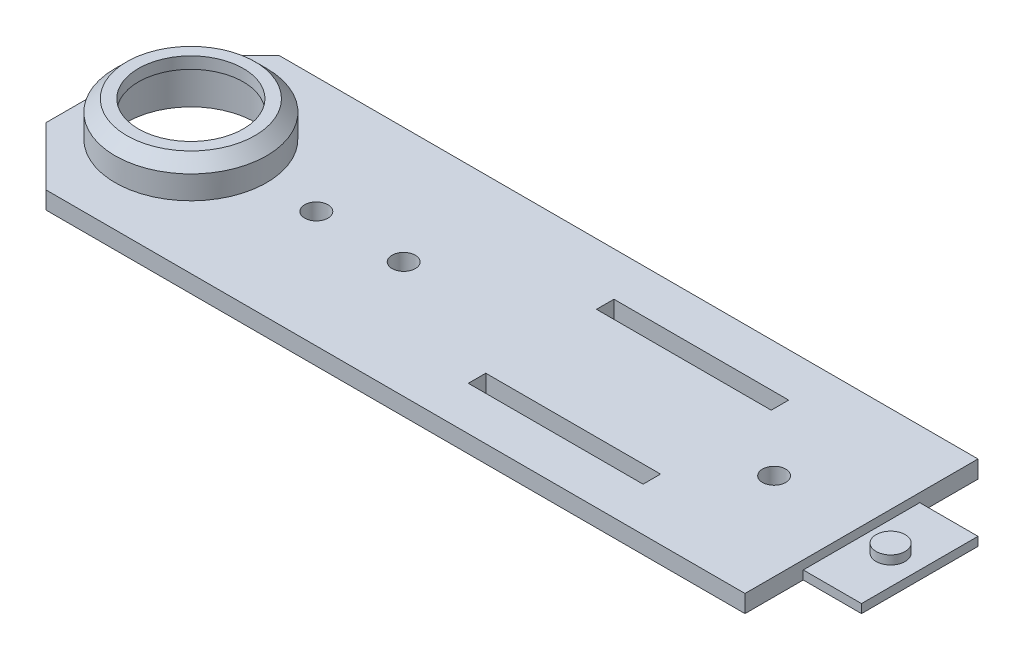
from build123d import *

# Parameters (mm, degrees)
CROQUIS1_R              = 11
CROQUIS1_R_2            = 2
CROQUIS1_W              = 30
CROQUIS1_H              = 3
SALIENTE_EXTRUIR1_DEPTH = 3
CROQUIS2_R              = 13
CROQUIS2_R_2            = 11
SALIENTE_EXTRUIR2_DEPTH = 4
CROQUIS3_R              = 13
CROQUIS3_R_2            = 9
SALIENTE_EXTRUIR3_DEPTH = 2
CHAFL_N1_SIZE           = 2
CHAFL_N2_SIZE           = 10
CROQUIS6_W              = 10
CROQUIS6_H              = 20
CROQUIS6_R              = 2.5
CORTAR_EXTRUIR2_DEPTH   = 1.5


with BuildPart() as part:
    # Croquis1 → Saliente-Extruir1 (new body)
    with BuildSketch(Plane(origin=(0, 0, 0), x_dir=(1, 0, 0), z_dir=(0, 1, 0))):
        Polygon((-65, -20), (65, -20), (65, -10), (75, -10), (75, 10), (65, 10), (65, 20), (-65, 20), align=None)
        with Locations((-50.129942902, 0)):
            Circle(CROQUIS1_R, mode=Mode.SUBTRACT)
        with Locations((-28.595127909, 0)):
            Circle(CROQUIS1_R_2, mode=Mode.SUBTRACT)
        with Locations((-13.595127909, 0)):
            Circle(CROQUIS1_R_2, mode=Mode.SUBTRACT)
        with Locations((50, 0)):
            Circle(CROQUIS1_R_2, mode=Mode.SUBTRACT)
        with Locations((25, 11)):
            Rectangle(CROQUIS1_W, CROQUIS1_H, mode=Mode.SUBTRACT)
        with Locations((25, -11)):
            Rectangle(CROQUIS1_W, CROQUIS1_H, mode=Mode.SUBTRACT)
    extrude(amount=SALIENTE_EXTRUIR1_DEPTH)

    # Croquis2 → Saliente-Extruir2 (add)
    with BuildSketch(Plane(origin=(0, 3, 0), x_dir=(1, 0, 0), z_dir=(0, 1, 0))):
        with Locations((-50.129942902, 0)):
            Circle(CROQUIS2_R)
        with Locations((-50.129942902, 0)):
            Circle(CROQUIS2_R_2, mode=Mode.SUBTRACT)
    extrude(amount=SALIENTE_EXTRUIR2_DEPTH)

    # Croquis3 → Saliente-Extruir3 (add)
    with BuildSketch(Plane(origin=(0, 7, 0), x_dir=(1, 0, 0), z_dir=(0, 1, 0))):
        with Locations((-50.129942902, 0)):
            Circle(CROQUIS3_R)
        with Locations((-50.129942902, 0)):
            Circle(CROQUIS3_R_2, mode=Mode.SUBTRACT)
    extrude(amount=SALIENTE_EXTRUIR3_DEPTH)

    # Chaflán1
    chafl_n1_edges = [part.edges().sort_by_distance(p)[0] for p in [
        (-63.129942902, 9, 0),
    ]]
    chamfer(chafl_n1_edges, length=CHAFL_N1_SIZE)

    # Chaflán2
    chafl_n2_edges = [part.edges().sort_by_distance(p)[0] for p in [
        (-65, 1.5, 20),
        (-65, 1.5, -20),
    ]]
    chamfer(chafl_n2_edges, length=CHAFL_N2_SIZE)

    # Croquis6 → Cortar-Extruir2 (cut)
    with BuildSketch(Plane(origin=(0, 3, 0), x_dir=(1, 0, 0), z_dir=(0, 1, 0))):
        with Locations((70, 0)):
            Rectangle(CROQUIS6_W, CROQUIS6_H)
        with Locations((70, 0)):
            Circle(CROQUIS6_R, mode=Mode.SUBTRACT)
    extrude(amount=-CORTAR_EXTRUIR2_DEPTH, mode=Mode.SUBTRACT)


solid = part.part
